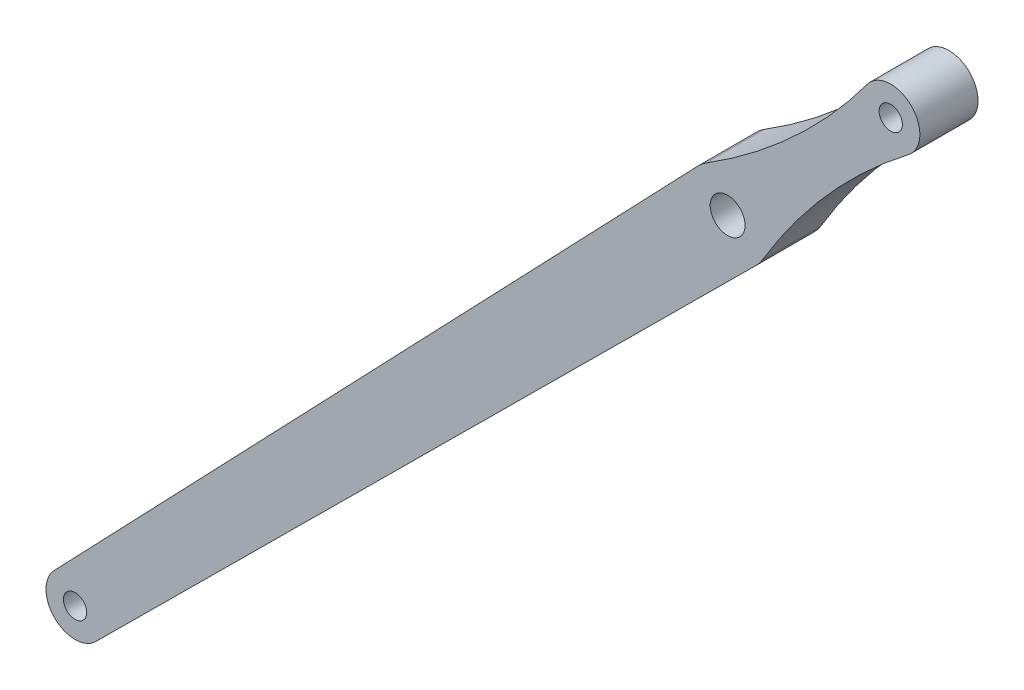
from build123d import *

# Parameters (mm, degrees)
BOSS_EXTRUDE1_DEPTH      = 5
BOSS_EXTRUDE1_DEPTH_BACK = 5
SKETCH1_R                = 2
SKETCH1_R_2              = 3


with BuildPart() as part:
    # Sketch1 → Boss-Extrude1 (new, two sides: drawn at the far end of the back side and taken through both)
    with BuildSketch(Plane.XY.offset(-BOSS_EXTRUDE1_DEPTH_BACK)):
        with BuildLine():
            Line((-238.213638268, 3.039985087), (-124.703938553, 115.785486418))
            ThreePointArc((-124.703938553, 115.785486418), (-124.120631142, 116.442592003), (-123.624237707, 117.167594652))
            ThreePointArc((-123.624237707, 117.167594652), (-112.435588499, 132.437325954), (-98.569806402, 145.324942178))
            ThreePointArc((-98.569806402, 145.324942178), (-98.108738471, 152.860684767), (-105.634814836, 152.26220791))
            ThreePointArc((-105.634814836, 152.26220791), (-118.267312076, 138.163605902), (-133.330370788, 126.698230752))
            ThreePointArc((-133.330370788, 126.698230752), (-134.046196327, 126.188692645), (-134.692550402, 125.593493776))
            Line((-134.692550402, 125.593493776), (-245.348361018, 10.045704628))
            ThreePointArc((-245.348361018, 10.045704628), (-245.240343938, 3.019800251), (-238.213638268, 3.039985087))
        make_face()
        with Locations((-241.737210475, 6.587440358)):
            Circle(SKETCH1_R, mode=Mode.SUBTRACT)
        with Locations((-129.636939642, 120.751923799)):
            Circle(SKETCH1_R_2, mode=Mode.SUBTRACT)
        with Locations((-101.611871934, 149.293044659)):
            Circle(SKETCH1_R, mode=Mode.SUBTRACT)
    extrude(amount=BOSS_EXTRUDE1_DEPTH + BOSS_EXTRUDE1_DEPTH_BACK)


solid = part.part
